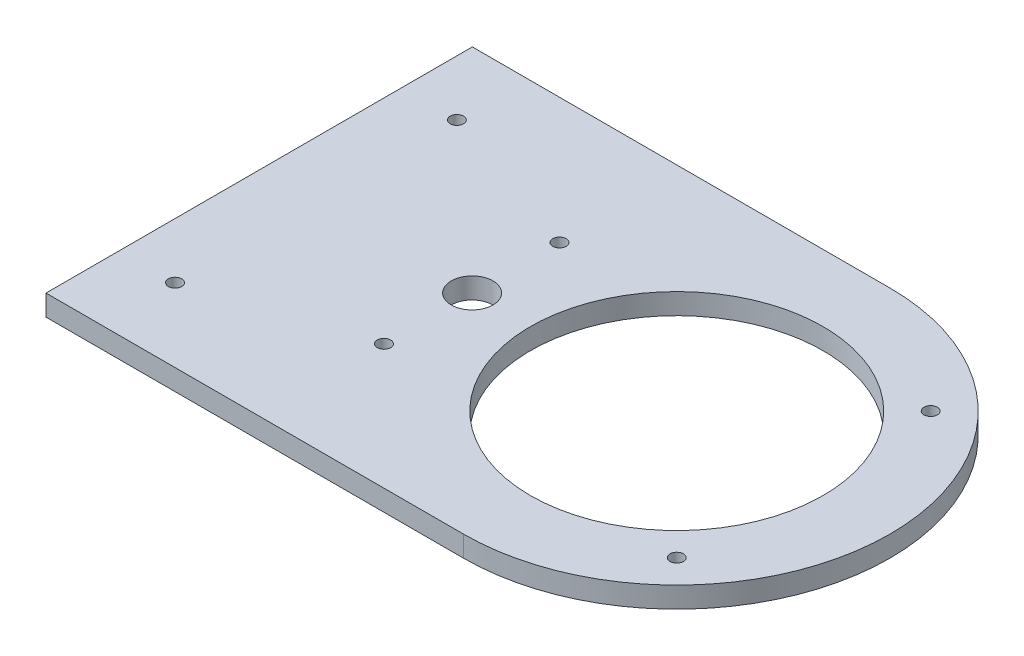
from build123d import *

# Parameters (mm, degrees)
SKETCH1_W                                           = 178
SKETCH1_H                                           = 102.1
SKETCH1_R                                           = 35.05
SKETCH1_R_2                                         = 5
BOSS_EXTRUDE1_DEPTH                                 = 5
CSK_FOR_M3_COUNTERSUNK_FLAT_HEAD_SCREW1_D           = 3.2
CSK_FOR_M3_COUNTERSUNK_FLAT_HEAD_SCREW1_CSINK_D     = 6.3
CSK_FOR_M3_COUNTERSUNK_FLAT_HEAD_SCREW1_CSINK_ANGLE = 90
CUT_EXTRUDE2_DEPTH                                  = 113.388177759
CSK_FOR_M3_COUNTERSUNK_FLAT_HEAD_SCREW2_D           = 3.2
CSK_FOR_M3_COUNTERSUNK_FLAT_HEAD_SCREW2_CSINK_D     = 6.3
CSK_FOR_M3_COUNTERSUNK_FLAT_HEAD_SCREW2_CSINK_ANGLE = 90
CSK_FOR_M3_COUNTERSUNK_FLAT_HEAD_SCREW3_D           = 3.2
CSK_FOR_M3_COUNTERSUNK_FLAT_HEAD_SCREW3_CSINK_D     = 6.3
CSK_FOR_M3_COUNTERSUNK_FLAT_HEAD_SCREW3_CSINK_ANGLE = 90


with BuildPart() as part:
    # Sketch1 → Boss-Extrude1 (new body)
    with BuildSketch(Plane(origin=(0, 0, 0), x_dir=(1, 0, 0), z_dir=(0, 1, 0))):
        with Locations((-11, 0)):
            Rectangle(SKETCH1_W, SKETCH1_H)
        Circle(SKETCH1_R, mode=Mode.SUBTRACT)
        with Locations((-49, 0)):
            Circle(SKETCH1_R_2, mode=Mode.SUBTRACT)
    extrude(amount=BOSS_EXTRUDE1_DEPTH)

    # CSK for M3 Countersunk Flat Head Screw1 (through all)
    with Locations(Plane(origin=(0, 0, 0), x_dir=(-1, 0, 0), z_dir=(0, -1, 0))):
        with Locations((-30.405591591, -30.405591591), (-30.405591591, 30.405591591)):
            CounterSinkHole(CSK_FOR_M3_COUNTERSUNK_FLAT_HEAD_SCREW1_D / 2, CSK_FOR_M3_COUNTERSUNK_FLAT_HEAD_SCREW1_CSINK_D / 2, counter_sink_angle=CSK_FOR_M3_COUNTERSUNK_FLAT_HEAD_SCREW1_CSINK_ANGLE)

    # Sketch12 → Cut-Extrude2 (cut, through all)
    with BuildSketch(Plane(origin=(0, 5, 0), x_dir=(1, 0, 0), z_dir=(0, 1, 0))):
        with BuildLine():
            Line((0, 51.05), (78, 51.05))
            Line((78, 51.05), (78, -51.05))
            Line((78, -51.05), (0, -51.05))
            ThreePointArc((0, -51.05), (51.05, 0), (0, 51.05))
        make_face()
    extrude(amount=-CUT_EXTRUDE2_DEPTH, mode=Mode.SUBTRACT)

    # CSK for M3 Countersunk Flat Head Screw2 (through all)
    with Locations(Plane(origin=(0, 0, 0), x_dir=(-1, 0, 0), z_dir=(0, -1, 0))):
        with Locations((49, 20.91), (49, -21.11)):
            CounterSinkHole(CSK_FOR_M3_COUNTERSUNK_FLAT_HEAD_SCREW2_D / 2, CSK_FOR_M3_COUNTERSUNK_FLAT_HEAD_SCREW2_CSINK_D / 2, counter_sink_angle=CSK_FOR_M3_COUNTERSUNK_FLAT_HEAD_SCREW2_CSINK_ANGLE)

    # CSK for M3 Countersunk Flat Head Screw3 (through all)
    with Locations(Plane(origin=(0, 0, 0), x_dir=(-1, 0, 0), z_dir=(0, -1, 0))):
        with Locations((86.7, 34.05), (86.7, -33.45)):
            CounterSinkHole(CSK_FOR_M3_COUNTERSUNK_FLAT_HEAD_SCREW3_D / 2, CSK_FOR_M3_COUNTERSUNK_FLAT_HEAD_SCREW3_CSINK_D / 2, counter_sink_angle=CSK_FOR_M3_COUNTERSUNK_FLAT_HEAD_SCREW3_CSINK_ANGLE)


solid = part.part
